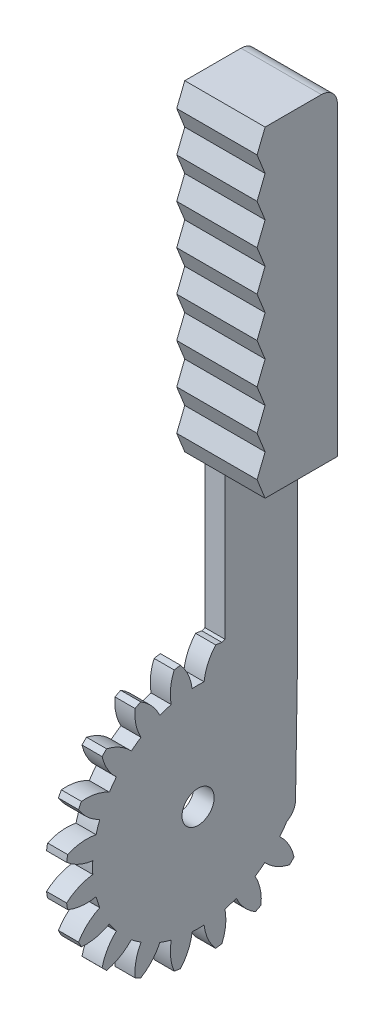
from build123d import *

# Parameters (mm, degrees)
BASPROSKE_W         = 2.5
BASPROSKE_H         = 16.5
TOOTHCUT_DEPTH      = 24.468063405
TEETHCUTS_COUNT     = 20
TEETHCUTS_ANGLE     = 342
BORSKE_R            = 2
BORE_DEPTH          = 50.0000508
SKETCH1_W           = 9
SKETCH1_H           = 70
BOSS_EXTRUDE2_DEPTH = 2.5
BOSS_EXTRUDE3_DEPTH = 2.5
LPATTERN2_COUNT     = 8
LPATTERN2_PITCH     = 5
CUT_EXTRUDE1_DEPTH  = 3
FILLET3_R           = 2
FILLET4_R           = 2
BOSS_EXTRUDE4_START = -2.5
BOSS_EXTRUDE4_DEPTH = 2.5
BOSS_EXTRUDE5_DEPTH = 5


with BuildPart() as part:
    # BasProSke → Base-Revolve (revolve)
    with BuildSketch(Plane(origin=(0, 0, 0), x_dir=(1, 0, 0), z_dir=(0, 1, 0)), mode=Mode.PRIVATE) as base_revolve_sk:
        with Locations((1.25, 8.25)):
            Rectangle(BASPROSKE_W, BASPROSKE_H)
    revolve(base_revolve_sk.sketch.rotate(Axis((-10, 0, 0), (1, 0, 0)), 180), axis=Axis((-10, 0, 0), (1, 0, 0)))

    # TooCutSke → ToothCut (cut, through all)
    with BuildSketch(Plane(origin=(0, 0, 0), x_dir=(0, 0, -1), z_dir=(1, 0, 0))):
        with BuildLine():
            ThreePointArc((0.74381438, 13.102904875), (0, 13.124), (-0.74381438, 13.102904875))
            ThreePointArc((-0.74381438, 13.102904875), (-1.226473103, 14.852072512), (-2.209965745, 16.376962373))
            ThreePointArc((-2.209965745, 16.376962373), (0, 16.5254), (2.209965745, 16.376962373))
            ThreePointArc((2.209965745, 16.376962373), (1.226473103, 14.852072512), (0.74381438, 13.102904875))
        make_face()
    toothcut = extrude(amount=TOOTHCUT_DEPTH, mode=Mode.SUBTRACT)

    # TeethCuts: ToothCut ×20 about axis
    teethcuts_axis = Axis((-10, 0, 0), (1, 0, 0))
    for i in range(1, TEETHCUTS_COUNT):
        add(toothcut.rotate(teethcuts_axis, i * TEETHCUTS_ANGLE / (TEETHCUTS_COUNT - 1)), mode=Mode.SUBTRACT)

    # BorSke → Bore (cut, symmetric)
    with BuildSketch(Plane(origin=(0, 0, 0), x_dir=(0, 0, -1), z_dir=(1, 0, 0))):
        with Locations(Location((0, 0, 0), (0, 0, 180))):
            Circle(BORSKE_R)
    extrude(amount=BORE_DEPTH, both=True, mode=Mode.SUBTRACT)

    # Sketch1 → Boss-Extrude2 (add)
    with BuildSketch(Plane(origin=(2.5, 0, 0), x_dir=(0, 0, -1), z_dir=(1, 0, 0))):
        with Locations((7.841610769, 39.08106639)):
            Rectangle(SKETCH1_W, SKETCH1_H)
    extrude(amount=-BOSS_EXTRUDE2_DEPTH)

    # Sketch2 → Boss-Extrude3 (add)
    with BuildSketch(Plane(origin=(2.5, 0, 0), x_dir=(0, 0, -1), z_dir=(1, 0, 0))):
        Polygon((2.341610769, 71.58106639), (3.341610769, 69.08106639), (3.341610769, 74.08106639), align=None)
    boss_extrude3 = extrude(amount=-BOSS_EXTRUDE3_DEPTH)

    # LPattern2: Boss-Extrude3 ×8
    with Locations(*[(0, -i * LPATTERN2_PITCH, 0) for i in range(1, LPATTERN2_COUNT)]):
        add(boss_extrude3)

    # Sketch3 → Cut-Extrude1 (cut)
    with BuildSketch(Plane(origin=(2.5, 0, 0), x_dir=(0, 0, -1), z_dir=(1, 0, 0))):
        Polygon((12.341610769, 7.640465379), (11.943579641, -16.474016898), (28.120591599, -19.002507116), (23.794346737, 10.948418847), align=None)
    extrude(amount=-CUT_EXTRUDE1_DEPTH, mode=Mode.SUBTRACT)

    # Fillet3
    # the kernel refuses this fillet: 2 mm, written as the material it takes off along each edge
    with BuildSketch(Plane(origin=(8.029722145, -7.563673717, -12.090652836), x_dir=(0, 0.40305029289493355, 0.9151778304773931), z_dir=(-1, 0, 0))) as fillet3_piece_1:
        with BuildLine():
            CenterArc((2.701383145, 1.26292574), FILLET3_R, 157.176626249, 61.981506818)
            Line((0.857973168, 2.038708994), (0.821104969, 2.054224659))
            Line((0.821104969, 2.054224659), (-0.0368682, 0.015515665))
            Line((-0.0368682, 0.015515665), (-0.003835236, -0.039815713))
            ThreePointArc((-0.003835236, -0.039815713), (0.575285457, -0.067643125), (1.119554669, -0.025258515))
            Line((1.119554669, -0.025258515), (1.150570914, 0))
        make_face()
    extrude(amount=13.55944429, mode=Mode.SUBTRACT)

    # Fillet4
    fillet4_edges = [part.edges().sort_by_distance(p)[0] for p in [
        (1.25, 74.08106639, -12.341610769),
    ]]
    fillet(fillet4_edges, radius=FILLET4_R)

    # Sketch5 → Boss-Extrude4 (add)
    with BuildSketch(Plane(origin=(2.5, 0, 0), x_dir=(0, 0, -1), z_dir=(1, 0, 0)).offset(BOSS_EXTRUDE4_START)):
        with BuildLine():
            ThreePointArc((3.341610769, 15.036857875), (3.187495997, 15.643253498), (2.971070911, 16.230303067))
            Line((2.971070911, 16.230303067), (3.341610769, 16.389315184))
            Line((3.341610769, 16.389315184), (3.341610769, 15.036857875))
        make_face()
    extrude(amount=BOSS_EXTRUDE4_DEPTH)

    # Sketch6 → Boss-Extrude5 (add, symmetric)
    with BuildSketch(Plane(origin=(2.5, 0, 0), x_dir=(0, 0, -1), z_dir=(1, 0, 0))):
        with BuildLine():
            Line((3.341610769, 34.08106639), (12.341610769, 34.08106639))
            Line((12.341610769, 34.08106639), (12.341610769, 72.08106639))
            ThreePointArc((12.341610769, 72.08106639), (11.755824331, 73.495279952), (10.341610769, 74.08106639))
            Line((10.341610769, 74.08106639), (3.341610769, 74.08106639))
            Line((3.341610769, 74.08106639), (2.341610769, 71.58106639))
            Line((2.341610769, 71.58106639), (3.341610769, 69.08106639))
            Line((3.341610769, 69.08106639), (2.341610769, 66.58106639))
            Line((2.341610769, 66.58106639), (3.341610769, 64.08106639))
            Line((3.341610769, 64.08106639), (2.341610769, 61.58106639))
            Line((2.341610769, 61.58106639), (3.341610769, 59.08106639))
            Line((3.341610769, 59.08106639), (2.341610769, 56.58106639))
            Line((2.341610769, 56.58106639), (3.341610769, 54.08106639))
            Line((3.341610769, 54.08106639), (2.341610769, 51.58106639))
            Line((2.341610769, 51.58106639), (3.341610769, 49.08106639))
            Line((3.341610769, 49.08106639), (2.341610769, 46.58106639))
            Line((2.341610769, 46.58106639), (3.341610769, 44.08106639))
            Line((3.341610769, 44.08106639), (2.341610769, 41.58106639))
            Line((2.341610769, 41.58106639), (3.341610769, 39.08106639))
            Line((3.341610769, 39.08106639), (2.341610769, 36.58106639))
            Line((2.341610769, 36.58106639), (3.341610769, 34.08106639))
        make_face()
    extrude(amount=BOSS_EXTRUDE5_DEPTH, both=True)


solid = part.part
